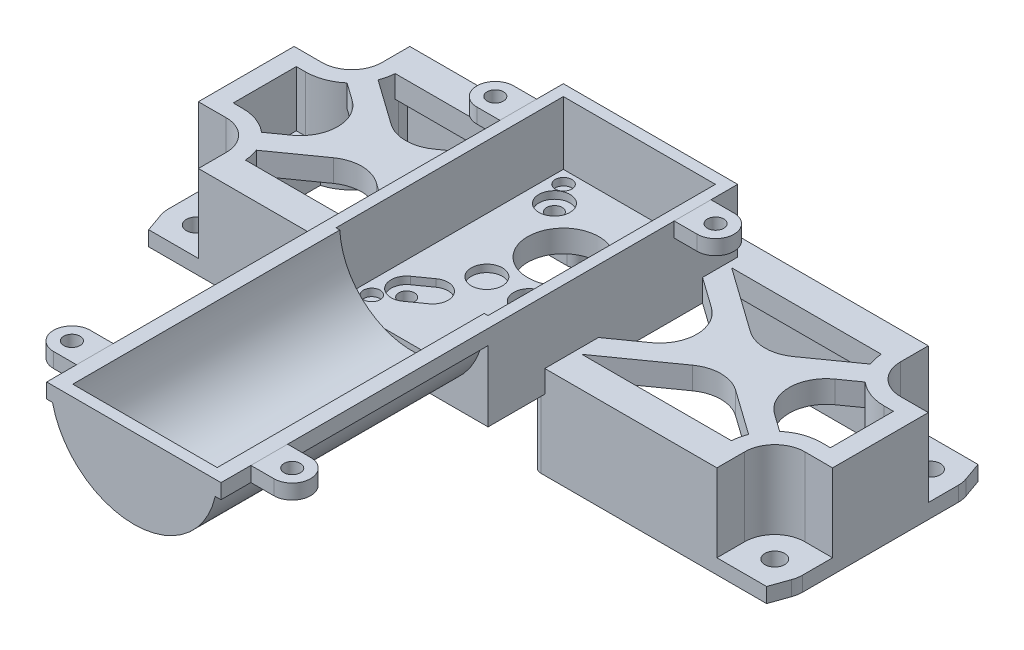
from build123d import *

# Parameters (mm, degrees)
SKETCH1_R             = 2.65
BOSS_EXTRUDE4_DEPTH   = 4
BOSS_EXTRUDE4_2_DEPTH = 4
BOSS_EXTRUDE5_DEPTH   = 15
BOSS_EXTRUDE6_DEPTH   = 6
SKETCH7_R             = 2.25
SKETCH7_R_2           = 4.2
SKETCH7_R_3           = 9.6
CUT_EXTRUDE1_DEPTH    = 2
SKETCH8_R             = 2.1
SKETCH8_R_2           = 9.6
CUT_EXTRUDE2_DEPTH    = 176.267481296
BOSS_EXTRUDE7_DEPTH   = 19
SKETCH12_W            = 47
SKETCH12_H            = 75
SKETCH12_W_2          = 3
SKETCH12_H_2          = 3
BOSS_EXTRUDE12_DEPTH  = 17
SKETCH13_W            = 47
SKETCH13_H            = 78
BOSS_EXTRUDE13_DEPTH  = 6
CUT_EXTRUDE4_START    = -3
CUT_EXTRUDE4_DEPTH    = 72
SKETCH15_R            = 4.95
SKETCH15_R_2          = 2.2
BOSS_EXTRUDE15_DEPTH  = 4
CUT_EXTRUDE5_DEPTH    = 72
SKETCH19_W            = 6
SKETCH19_H            = 18
BOSS_EXTRUDE17_DEPTH  = 10


# Read off the part's stored shape, not the designer's step: Boss-Extrude5
with BuildPart() as part:
    # Sketch1 → Boss-Extrude4 (new body)
    with BuildSketch(Plane(origin=(0, 0, 0), x_dir=(1, 0, 0), z_dir=(0, 1, 0))):
        with BuildLine():
            ThreePointArc((-7.071067812, 2.5), (-7.391989197, 1.26826484), (-7.5, 0))
            Line((-7.5, 0), (-7.5, -42))
            ThreePointArc((-7.5, -42), (-7.391989197, -43.26826484), (-7.071067812, -44.5))
            Line((-7.071067812, -44.5), (-5.300474949, -49.5))
            Line((-5.300474949, -49.5), (12.5, -49.5))
            Line((12.5, -49.5), (12.5, -42))
            ThreePointArc((12.5, -42), (8.838834765, -33.161165235), (0, -29.5))
            Line((0, -29.5), (-2.5, -29.5))
            Line((-2.5, -29.5), (-2.5, -12.5))
            Line((-2.5, -12.5), (0, -12.5))
            ThreePointArc((0, -12.5), (8.838834765, -8.838834765), (12.5, 0))
            Line((12.5, 0), (12.5, 7.5))
            Line((12.5, 7.5), (-5.300474949, 7.5))
            Line((-5.300474949, 7.5), (-7.071067812, 2.5))
        make_face()
        with Locations(Location((0, 0, 0), (0, 0, 270))):
            Circle(SKETCH1_R, mode=Mode.SUBTRACT)
        with Locations(Location((0, -42, 0), (0, 0, 270))):
            Circle(SKETCH1_R, mode=Mode.SUBTRACT)
    extrude(amount=BOSS_EXTRUDE4_DEPTH)



with BuildPart() as body_2:
    # Sketch1 → Boss-Extrude4 2 (new body)
    with BuildSketch(Plane(origin=(0, 0, 0), x_dir=(1, 0, 0), z_dir=(0, 1, 0))):
        with BuildLine():
            ThreePointArc((163.5, 0), (163.391989197, 1.26826484), (163.071067812, 2.5))
            Line((163.071067812, 2.5), (161.300474949, 7.5))
            Line((161.300474949, 7.5), (143.5, 7.5))
            Line((143.5, 7.5), (143.5, 0))
            ThreePointArc((143.5, 0), (147.161165235, -8.838834765), (156, -12.5))
            Line((156, -12.5), (158.5, -12.5))
            Line((158.5, -12.5), (158.5, -29.5))
            Line((158.5, -29.5), (156, -29.5))
            ThreePointArc((156, -29.5), (147.161165235, -33.161165235), (143.5, -42))
            Line((143.5, -42), (143.5, -49.5))
            Line((143.5, -49.5), (161.300474949, -49.5))
            Line((161.300474949, -49.5), (163.071067812, -44.5))
            ThreePointArc((163.071067812, -44.5), (163.391989197, -43.26826484), (163.5, -42))
            Line((163.5, -42), (163.5, 0))
        make_face()
        with Locations(Location((156, 0, 0), (0, 0, 270))):
            Circle(SKETCH1_R, mode=Mode.SUBTRACT)
        with Locations(Location((156, -42, 0), (0, 0, 270))):
            Circle(SKETCH1_R, mode=Mode.SUBTRACT)
    extrude(amount=BOSS_EXTRUDE4_2_DEPTH)


with BuildPart() as part_1:
    add(part.part)

    add(body_2.part)  # Boss-Extrude5 merges body 2
    # Boss-Extrude5 outline → Boss-Extrude5 (add)
    with BuildSketch(Plane(origin=(0, 4, 0), x_dir=(1, 0, 0), z_dir=(0, 1, 0))):
        with BuildLine():
            Line((8.1, -49.5), (12.5, -49.5))
            Line((12.5, -49.5), (12.5, -42))
            ThreePointArc((12.5, -42), (8.838834765, -33.161165235), (0, -29.5))
            Line((0, -29.5), (-2.5, -29.5))
            Line((-2.5, -29.5), (-2.5, -12.5))
            Line((-2.5, -12.5), (0, -12.5))
            ThreePointArc((0, -12.5), (8.838834765, -8.838834765), (12.5, 0))
            Line((12.5, 0), (12.5, 7.5))
            Line((12.5, 7.5), (8.1, 7.5))
            Line((8.1, 7.5), (8.1, 0))
            ThreePointArc((8.1, 0), (5.715908211, -5.739197969), (-0.032936623, -8.099933035))
            Line((-0.032936623, -8.099933035), (-7.5, -8.0847515))
            Line((-7.5, -8.0847515), (-7.5, -33.9152485))
            Line((-7.5, -33.9152485), (-0.032936623, -33.900066965))
            ThreePointArc((-0.032936623, -33.900066965), (5.715908211, -36.260802031), (8.1, -42))
            Line((8.1, -42), (8.1, -49.5))
        make_face()
        with BuildLine():
            Line((143.5, -49.5), (147.9, -49.5))
            Line((147.9, -49.5), (147.9, -42))
            ThreePointArc((147.9, -42), (150.284091789, -36.260802031), (156.032936623, -33.900066965))
            Line((156.032936623, -33.900066965), (163.5, -33.9152485))
            Line((163.5, -33.9152485), (163.5, -8.0847515))
            Line((163.5, -8.0847515), (156.032936623, -8.099933035))
            ThreePointArc((156.032936623, -8.099933035), (150.284091789, -5.739197969), (147.9, 0))
            Line((147.9, 0), (147.9, 7.5))
            Line((147.9, 7.5), (143.5, 7.5))
            Line((143.5, 7.5), (143.5, 0))
            ThreePointArc((143.5, 0), (147.161165235, -8.838834765), (156, -12.5))
            Line((156, -12.5), (158.5, -12.5))
            Line((158.5, -12.5), (158.5, -29.5))
            Line((158.5, -29.5), (156, -29.5))
            ThreePointArc((156, -29.5), (147.161165235, -33.161165235), (143.5, -42))
            Line((143.5, -42), (143.5, -49.5))
        make_face()
    extrude(amount=BOSS_EXTRUDE5_DEPTH)

    # Sketch6 → Boss-Extrude6 (add)
    with BuildSketch(Plane(origin=(0, 19, 0), x_dir=(1, 0, 0), z_dir=(0, 1, 0))):
        with BuildLine():
            Line((101.5, -49.5), (147.9, -49.5))
            Line((147.9, -49.5), (147.9, -42))
            ThreePointArc((147.9, -42), (150.284091789, -36.260802031), (156.032936623, -33.900066965))
            Line((156.032936623, -33.900066965), (163.5, -33.9152485))
            Line((163.5, -33.9152485), (163.5, -8.0847515))
            Line((163.5, -8.0847515), (156.032936623, -8.099933035))
            ThreePointArc((156.032936623, -8.099933035), (150.284091789, -5.739197969), (147.9, 0))
            Line((147.9, 0), (147.9, 7.5))
            Line((147.9, 7.5), (8.1, 7.5))
            Line((8.1, 7.5), (8.1, 0))
            ThreePointArc((8.1, 0), (5.727564928, -5.727564928), (0, -8.1))
            Line((0, -8.1), (-7.5, -8.0847515))
            Line((-7.5, -8.0847515), (-7.5, -33.9152485))
            Line((-7.5, -33.9152485), (0, -33.9))
            ThreePointArc((0, -33.9), (5.727564928, -36.272435072), (8.1, -42))
            Line((8.1, -42), (8.1, -49.5))
            Line((8.1, -49.5), (54.5, -49.5))
            Line((54.5, -49.5), (54.5, -58.8))
            Line((54.5, -58.8), (101.5, -58.8))
            Line((101.5, -58.8), (101.5, -49.5))
        make_face()
        with BuildLine():
            Line((35.354194865, -28.793521079), (52.819626356, -41.2))
            Line((52.819626356, -41.2), (12.474373732, -41.2))
            ThreePointArc((12.474373732, -41.2), (12.199654375, -39.276319929), (11.630112062, -37.418461675))
            Line((11.630112062, -37.418461675), (23.772018728, -28.793521079))
            ThreePointArc((23.772018728, -28.793521079), (29.563106796, -26.946023699), (35.354194865, -28.793521079))
        make_face(mode=Mode.SUBTRACT)
        with BuildLine():
            Line((103.180373644, -41.2), (120.645805135, -28.793521079))
            ThreePointArc((120.645805135, -28.793521079), (126.436893204, -26.946023699), (132.227981272, -28.793521079))
            Line((132.227981272, -28.793521079), (144.369887938, -37.418461675))
            ThreePointArc((144.369887938, -37.418461675), (143.800345625, -39.276319929), (143.525626268, -41.2))
            Line((143.525626268, -41.2), (103.180373644, -41.2))
        make_face(mode=Mode.SUBTRACT)
        with BuildLine():
            Line((0, -29.5), (-2.5, -29.5))
            Line((-2.5, -29.5), (-2.5, -12.5))
            Line((-2.5, -12.5), (0, -12.5))
            ThreePointArc((0, -12.5), (4.349540279, -11.718852305), (8.155459221, -9.473039897))
            Line((8.155459221, -9.473039897), (12.905909074, -12.847497379))
            ThreePointArc((12.905909074, -12.847497379), (17.114821006, -21), (12.905909074, -29.152502621))
            Line((12.905909074, -29.152502621), (8.155459221, -32.526960103))
            ThreePointArc((8.155459221, -32.526960103), (4.349540279, -30.281147695), (0, -29.5))
        make_face(mode=Mode.SUBTRACT)
        with BuildLine():
            Line((54.5, -35.033941481), (46.220304518, -29.152502621))
            ThreePointArc((46.220304518, -29.152502621), (42.011392586, -21), (46.220304518, -12.847497379))
            Line((46.220304518, -12.847497379), (54.5, -6.966058519))
            Line((54.5, -6.966058519), (54.5, -35.033941481))
        make_face(mode=Mode.SUBTRACT)
        with BuildLine():
            Line((12.474373732, -0.8), (52.819626356, -0.8))
            Line((52.819626356, -0.8), (35.354194865, -13.206478921))
            ThreePointArc((35.354194865, -13.206478921), (29.563106796, -15.053976301), (23.772018728, -13.206478921))
            Line((23.772018728, -13.206478921), (11.630112062, -4.581538325))
            ThreePointArc((11.630112062, -4.581538325), (12.199654375, -2.723680071), (12.474373732, -0.8))
        make_face(mode=Mode.SUBTRACT)
        with BuildLine():
            Line((101.5, -35.033941481), (101.5, -6.966058519))
            Line((101.5, -6.966058519), (109.779695482, -12.847497379))
            ThreePointArc((109.779695482, -12.847497379), (113.988607414, -21), (109.779695482, -29.152502621))
            Line((109.779695482, -29.152502621), (101.5, -35.033941481))
        make_face(mode=Mode.SUBTRACT)
        with BuildLine():
            Line((158.5, -29.5), (156, -29.5))
            ThreePointArc((156, -29.5), (151.650459721, -30.281147695), (147.844540779, -32.526960103))
            Line((147.844540779, -32.526960103), (143.094090926, -29.152502621))
            ThreePointArc((143.094090926, -29.152502621), (138.885178994, -21), (143.094090926, -12.847497379))
            Line((143.094090926, -12.847497379), (147.844540779, -9.473039897))
            ThreePointArc((147.844540779, -9.473039897), (151.650459721, -11.718852305), (156, -12.5))
            Line((156, -12.5), (158.5, -12.5))
            Line((158.5, -12.5), (158.5, -29.5))
        make_face(mode=Mode.SUBTRACT)
        with BuildLine():
            Line((103.180373644, -0.8), (143.525626268, -0.8))
            ThreePointArc((143.525626268, -0.8), (143.800345625, -2.723680071), (144.369887938, -4.581538325))
            Line((144.369887938, -4.581538325), (132.227981272, -13.206478921))
            ThreePointArc((132.227981272, -13.206478921), (126.436893204, -15.053976301), (120.645805135, -13.206478921))
            Line((120.645805135, -13.206478921), (103.180373644, -0.8))
        make_face(mode=Mode.SUBTRACT)
    extrude(amount=BOSS_EXTRUDE6_DEPTH)

    # Sketch7 → Cut-Extrude1 (cut)
    with BuildSketch(Plane(origin=(0, 25, 0), x_dir=(1, 0, 0), z_dir=(0, 1, 0))):
        with Locations(Location((61, -55.65, 0), (0, 0, 270))):
            Circle(SKETCH7_R)
        with BuildLine():
            ThreePointArc((68.45, -49.5), (66.174681792, -45.766958345), (61.814, -46.078610808))
            ThreePointArc((61.814, -46.078610808), (60.828610808, -51.936), (66.686, -52.921389192))
            ThreePointArc((66.686, -52.921389192), (67.983041655, -51.424681792), (68.45, -49.5))
        make_face()
        with BuildLine():
            Line((85.240917629, -50.021389192), (89.314, -52.921389192))
            ThreePointArc((89.314, -52.921389192), (88.328610808, -47.064), (94.186, -46.078610808))
            Line((94.186, -46.078610808), (90.112917629, -43.178610808))
            ThreePointArc((90.112917629, -43.178610808), (84.255528438, -44.164), (85.240917629, -50.021389192))
        make_face()
        with Locations((91.75, -49.5)):
            Circle(SKETCH7_R_2)
        with Locations(Location((95, -55.65, 0), (0, 0, 270))):
            Circle(SKETCH7_R)
        with Locations(Location((83.725, -35.9, 0), (0, 0, 270))):
            Circle(SKETCH7_R_2)
        with Locations(Location((72.275, -35.9, 0), (0, 0, 270))):
            Circle(SKETCH7_R_2)
        with Locations(Location((78, -21, 0), (0, 0, 270))):
            Circle(SKETCH7_R_3)
        with Locations(Location((64.25, -9.65, 0), (0, 0, 270))):
            Circle(SKETCH7_R_2)
        with Locations(Location((61, -3.95, 0), (0, 0, 270))):
            Circle(SKETCH7_R)
        with Locations(Location((91.75, -9.65, 0), (0, 0, 270))):
            Circle(SKETCH7_R_2)
        with Locations(Location((95, -3.95, 0), (0, 0, 270))):
            Circle(SKETCH7_R)
        with BuildLine():
            Line((65.887082371, -43.178610808), (61.814, -46.078610808))
            ThreePointArc((61.814, -46.078610808), (66.174681792, -45.766958345), (68.45, -49.5))
            ThreePointArc((68.45, -49.5), (67.983041655, -51.424681792), (66.686, -52.921389192))
            Line((66.686, -52.921389192), (70.759082371, -50.021389192))
            ThreePointArc((70.759082371, -50.021389192), (71.744471562, -44.164), (65.887082371, -43.178610808))
        make_face()
    extrude(amount=-CUT_EXTRUDE1_DEPTH, mode=Mode.SUBTRACT)

    # Sketch8 → Cut-Extrude2 (cut, through all)
    with BuildSketch(Plane(origin=(0, 23, 0), x_dir=(1, 0, 0), z_dir=(0, 1, 0))):
        with Locations(Location((64.25, -9.65, 0), (0, 0, 270))):
            Circle(SKETCH8_R)
        with Locations(Location((91.75, -9.65, 0), (0, 0, 270))):
            Circle(SKETCH8_R)
        with Locations(Location((78, -21, 0), (0, 0, 270))):
            Circle(SKETCH8_R_2)
        with Locations(Location((91.75, -49.5, 0), (0, 0, 270))):
            Circle(SKETCH8_R)
        with Locations(Location((64.25, -49.5, 0), (0, 0, 270))):
            Circle(SKETCH8_R)
    extrude(amount=-CUT_EXTRUDE2_DEPTH, mode=Mode.SUBTRACT)

    # Sketch9 → Boss-Extrude7 (add, through all)
    with BuildSketch(Plane(origin=(0, 19, 0), x_dir=(-1, 0, 0), z_dir=(0, -1, 0))):
        with BuildLine():
            Line((-12.5, 2.5), (-12.5, 7.5))
            Line((-12.5, 7.5), (-55.5, 7.5))
            ThreePointArc((-55.5, 7.5), (-58, 5), (-55.5, 2.5))
            Line((-55.5, 2.5), (-12.5, 2.5))
        make_face()
        with BuildLine():
            Line((-12.5, -49.5), (-12.5, -44.5))
            Line((-12.5, -44.5), (-55.5, -44.5))
            ThreePointArc((-55.5, -44.5), (-58, -47), (-55.5, -49.5))
            Line((-55.5, -49.5), (-12.5, -49.5))
        make_face()
        with BuildLine():
            Line((-143.5, -44.5), (-143.5, -49.5))
            Line((-143.5, -49.5), (-100.5, -49.5))
            ThreePointArc((-100.5, -49.5), (-98, -47), (-100.5, -44.5))
            Line((-100.5, -44.5), (-143.5, -44.5))
        make_face()
        with BuildLine():
            Line((-143.5, 7.5), (-143.5, 2.5))
            Line((-143.5, 2.5), (-100.5, 2.5))
            ThreePointArc((-100.5, 2.5), (-98, 5), (-100.5, 7.5))
            Line((-100.5, 7.5), (-143.5, 7.5))
        make_face()
    extrude(amount=BOSS_EXTRUDE7_DEPTH)

    # Sketch12 → Boss-Extrude12 (add)
    with BuildSketch(Plane(origin=(0, 25, 0), x_dir=(1, 0, 0), z_dir=(0, 1, 0))):
        with Locations((78, -99.3)):
            Rectangle(SKETCH12_W, SKETCH12_H)
        Polygon((57.5, -0.5), (98.5, -0.5), (98.5, -58.8), (101.5, -58.8), (101.5, 2.5), (54.5, 2.5), (54.5, -58.8), (57.5, -58.8), align=None)
        with Locations((100, -60.3)):
            Rectangle(SKETCH12_W_2, SKETCH12_H_2)
        with Locations((56, -60.3)):
            Rectangle(SKETCH12_W_2, SKETCH12_H_2)
    extrude(amount=BOSS_EXTRUDE12_DEPTH)

    # Sketch13 → Boss-Extrude13 (add)
    with BuildSketch(Plane.XZ.offset(-25)):
        with Locations((78, 97.8)):
            Rectangle(SKETCH13_W, SKETCH13_H)
    extrude(amount=BOSS_EXTRUDE13_DEPTH)

    # Sketch14 → Cut-Extrude4 (cut)
    with BuildSketch(Plane.XY.offset(136.8).offset(CUT_EXTRUDE4_START)):
        with BuildLine():
            ThreePointArc((78, 23.5), (89.890121951, 27.544418484), (96.848076825, 38))
            Line((96.848076825, 38), (59.151923175, 38))
            ThreePointArc((59.151923175, 38), (66.109878049, 27.544418484), (78, 23.5))
        make_face()
        with BuildLine():
            Line((59.151923175, 38), (96.848076825, 38))
            ThreePointArc((96.848076825, 38), (97.265304253, 39.983702262), (97.474342094, 42))
            Line((97.474342094, 42), (58.525657906, 42))
            ThreePointArc((58.525657906, 42), (58.734695747, 39.983702262), (59.151923175, 38))
        make_face()
    extrude(amount=-CUT_EXTRUDE4_DEPTH, mode=Mode.SUBTRACT)

    # Sketch18 → Cut-Extrude5 (cut)
    with BuildSketch(Plane.XY.offset(136.8)):
        with BuildLine():
            Line((54.5, 19), (78, 19))
            Line((78, 19), (78, 20.5))
            ThreePointArc((78, 20.5), (63.9687848, 25.410940901), (56.062589032, 38))
            Line((56.062589032, 38), (54.5, 38))
            Line((54.5, 38), (54.5, 19))
        make_face()
        with BuildLine():
            Line((78, 20.5), (78, 19))
            Line((78, 19), (101.5, 19))
            Line((101.5, 19), (101.5, 38))
            Line((101.5, 38), (99.937410968, 38))
            ThreePointArc((99.937410968, 38), (92.0312152, 25.410940901), (78, 20.5))
        make_face()
    extrude(amount=-CUT_EXTRUDE5_DEPTH, mode=Mode.SUBTRACT)

    # Sketch19 → Boss-Extrude17 (add)
    with BuildSketch(Plane.XZ):
        with BuildLine():
            ThreePointArc((0, 12.5), (1.767766953, 12.374368671), (3.5, 12))
            Line((3.5, 12), (3.5, 30))
            ThreePointArc((3.5, 30), (1.767766953, 29.625631329), (0, 29.5))
            Line((0, 29.5), (-2.5, 29.5))
            Line((-2.5, 29.5), (-2.5, 12.5))
            Line((-2.5, 12.5), (0, 12.5))
        make_face()
        with Locations((155.5, 21)):
            Rectangle(SKETCH19_W, SKETCH19_H)
    extrude(amount=-BOSS_EXTRUDE17_DEPTH)


with BuildPart() as body_2_2:
    # Sketch15 → Boss-Extrude15 (new body)
    # profile 1 of 8: a face of its own
    with BuildSketch(Plane(origin=(0, 42, 0), x_dir=(1, 0, 0), z_dir=(0, 1, 0))):
        with BuildLine():
            Line((107.7, -118.85), (101.5, -118.85))
            Line((101.5, -118.85), (101.5, -128.75))
            Line((101.5, -128.75), (107.7, -128.75))
            ThreePointArc((107.7, -128.75), (102.75, -123.8), (107.7, -118.85))
        make_face()
    # profile 2 of 8: a face of its own
    with BuildSketch(Plane(origin=(0, 42, 0), x_dir=(1, 0, 0), z_dir=(0, 1, 0))):
        with Locations((107.7, -123.8)):
            Circle(SKETCH15_R)
        with Locations(Location((107.7, -123.8, 0), (0, 0, 270))):
            Circle(SKETCH15_R_2, mode=Mode.SUBTRACT)
    # profile 3 of 8: a face of its own
    with BuildSketch(Plane(origin=(0, 42, 0), x_dir=(1, 0, 0), z_dir=(0, 1, 0))):
        with BuildLine():
            ThreePointArc((53.25, -123.8), (51.800178567, -127.300178567), (48.3, -128.75))
            Line((48.3, -128.75), (54.5, -128.75))
            Line((54.5, -128.75), (54.5, -118.85))
            Line((54.5, -118.85), (48.3, -118.85))
            ThreePointArc((48.3, -118.85), (51.800178567, -120.299821433), (53.25, -123.8))
        make_face()
    # profile 4 of 8: a face of its own
    with BuildSketch(Plane(origin=(0, 42, 0), x_dir=(1, 0, 0), z_dir=(0, 1, 0))):
        with Locations((48.3, -123.8)):
            Circle(SKETCH15_R)
        with Locations(Location((48.3, -123.8, 0), (0, 0, 270))):
            Circle(SKETCH15_R_2, mode=Mode.SUBTRACT)
    # profile 5 of 8: a face of its own
    with BuildSketch(Plane(origin=(0, 42, 0), x_dir=(1, 0, 0), z_dir=(0, 1, 0))):
        with Locations((48.3, -9.65)):
            Circle(SKETCH15_R)
        with Locations(Location((48.3, -9.65, 0), (0, 0, 270))):
            Circle(SKETCH15_R_2, mode=Mode.SUBTRACT)
    # profile 6 of 8: a face of its own
    with BuildSketch(Plane(origin=(0, 42, 0), x_dir=(1, 0, 0), z_dir=(0, 1, 0))):
        with BuildLine():
            Line((48.3, -14.6), (54.5, -14.6))
            Line((54.5, -14.6), (54.5, -4.7))
            Line((54.5, -4.7), (48.3, -4.7))
            ThreePointArc((48.3, -4.7), (51.800178567, -6.149821433), (53.25, -9.65))
            ThreePointArc((53.25, -9.65), (51.800178567, -13.150178567), (48.3, -14.6))
        make_face()
    # profile 7 of 8: a face of its own
    with BuildSketch(Plane(origin=(0, 42, 0), x_dir=(1, 0, 0), z_dir=(0, 1, 0))):
        with Locations((107.7, -9.65)):
            Circle(SKETCH15_R)
        with Locations(Location((107.7, -9.65, 0), (0, 0, 270))):
            Circle(SKETCH15_R_2, mode=Mode.SUBTRACT)
    # profile 8 of 8: a face of its own
    with BuildSketch(Plane(origin=(0, 42, 0), x_dir=(1, 0, 0), z_dir=(0, 1, 0))):
        with BuildLine():
            Line((107.7, -4.7), (101.5, -4.7))
            Line((101.5, -4.7), (101.5, -14.6))
            Line((101.5, -14.6), (107.7, -14.6))
            ThreePointArc((107.7, -14.6), (102.75, -9.65), (107.7, -4.7))
        make_face()
    extrude(amount=-BOSS_EXTRUDE15_DEPTH)


solid = Compound([part_1.part, body_2_2.part])
